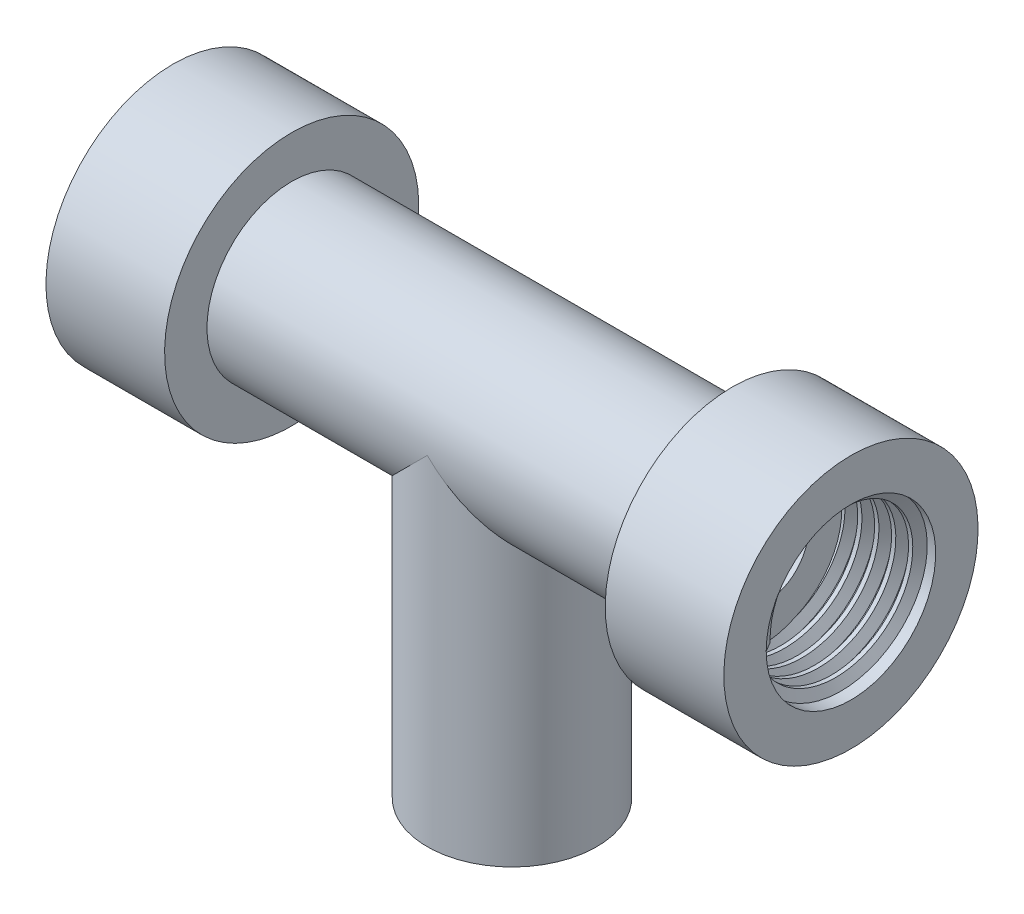
from build123d import *

# Parameters (mm, degrees)
SKETCH2_W          = 6.35
SKETCH2_H          = 25.4
SKETCH6_R          = 3.175
CUT_EXTRUDE1_DEPTH = 25.4
SKETCH7_R          = 3.175
CUT_EXTRUDE2_DEPTH = 44.704
THREAD1_PITCH      = 1.27
THREAD2_PITCH      = 1.27


with BuildPart() as part:
    # Sketch2 → Revolve1 (revolve)
    with BuildSketch(Plane.XY, mode=Mode.PRIVATE) as revolve1_sk:
        Rectangle(SKETCH2_W, SKETCH2_H)
    revolve(revolve1_sk.sketch.rotate(Axis((3.175, -12.7, 0), (0, 1, 0)), 270), axis=Axis((3.175, -12.7, 0), (0, 1, 0)))

    # Sketch4 → Revolve2 (revolve)
    with BuildSketch(Plane.XY, mode=Mode.PRIVATE) as revolve2_sk:
        Polygon((3.175, 12.7), (3.175, 6.35), (19.685, 6.35), (19.685, 3.175), (28.575, 3.175), (28.575, 6.35), (22.225, 6.35), (22.225, 12.7), align=None)
    revolve2 = revolve(revolve2_sk.sketch.rotate(Axis((22.225, 12.7, 0), (-1, 0, 0)), 180), axis=Axis((22.225, 12.7, 0), (-1, 0, 0)))

    # Mirror1: Revolve2 across plane
    add(revolve2.mirror(Plane(origin=(3.175, 12.7, 0), x_dir=(0, 0, 1), z_dir=(1, 0, 0))))

    # Sketch6 → Cut-Extrude1 (cut)
    with BuildSketch(Plane.XZ.offset(12.7)):
        with Locations(Location((3.175, 0, 0), (0, 0, 270))):
            Circle(SKETCH6_R)
    extrude(amount=-CUT_EXTRUDE1_DEPTH, mode=Mode.SUBTRACT)

    # Sketch7 → Cut-Extrude2 (cut)
    with BuildSketch(Plane(origin=(22.225, 0, 0), x_dir=(0, 0, -1), z_dir=(1, 0, 0))):
        with Locations(Location((0, 12.7, 0), (0, 0, 90))):
            Circle(SKETCH7_R)
    extrude(amount=-CUT_EXTRUDE2_DEPTH, mode=Mode.SUBTRACT)

    # Thread1: the profile of Thread Profile2 profile screwed along a right-hand helix of 5 turns, 8 arcs to a turn; built about Z, then put on its axis
    thread1_z = Axis((0, 0, 0), (0, 0, 1))
    thread1_corners = [(6.3503, 0, -0.000173205), (6.3503, 0, 1.111423202), (5.662592339, 0, 0.714374998), (5.662592339, 0, 0.396874998)]
    with BuildLine(mode=Mode.PRIVATE) as thread1_profile:
        Line(thread1_corners[0], thread1_corners[1])
        Line(thread1_corners[1], thread1_corners[2])
        Line(thread1_corners[2], thread1_corners[3])
        Line(thread1_corners[3], thread1_corners[0])
    thread1_cap = Face(thread1_profile.wire())
    thread1_turn_angles = [0, 22.5, 45, 67.5, 90, 112.5, 135, 157.5, 180, 202.5, 225, 247.5, 270, 292.5, 315, 337.5, 360]
    thread1_turn_weights = [1, 0.9238795325112867, 1, 0.9238795325112867, 1, 0.9238795325112867, 1, 0.9238795325112867, 1, 0.9238795325112867, 1, 0.9238795325112867, 1, 0.9238795325112867, 1, 0.9238795325112867, 1]
    thread1_turn_rails = [Edge.make_bspline([Vector(p[0], p[1], 0).rotate(thread1_z, thread1_turn_angles[k]) / thread1_turn_weights[k] + Vector(0, 0, p[2] + THREAD1_PITCH * thread1_turn_angles[k] / 360) for k in range(17)], [0, 0, 0, 1, 1, 2, 2, 3, 3, 4, 4, 5, 5, 6, 6, 7, 7, 8, 8, 8], 2, thread1_turn_weights) for p in thread1_corners]
    thread1_turn_sides = [Face.make_surface_from_curves(thread1_turn_rails[p[0]], thread1_turn_rails[p[1]]) for p in [(0, 1), (1, 2), (2, 3), (3, 0)]]
    thread1 = Plane(origin=(28.575, 12.7, 0), x_dir=(0, 0, 1), z_dir=(-1, 0, 0)) * Solid(Shell([*[p.moved(Location((0, 0, THREAD1_PITCH * i))) for i in range(5) for p in thread1_turn_sides], thread1_cap, thread1_cap.rotate(thread1_z, 1800).moved(Location((0, 0, THREAD1_PITCH * 1800 / 360)))]))
    add(thread1)

    # Thread2: the profile of Thread Profile3 profile screwed along a right-hand helix of 5 turns, 8 arcs to a turn; built about Z, then put on its axis
    thread2_z = Axis((0, 0, 0), (0, 0, 1))
    thread2_corners = [(6.3503, 0, -0.000173205), (6.3503, 0, 1.111423202), (5.662592339, 0, 0.714374998), (5.662592339, 0, 0.396874998)]
    with BuildLine(mode=Mode.PRIVATE) as thread2_profile:
        Line(thread2_corners[0], thread2_corners[1])
        Line(thread2_corners[1], thread2_corners[2])
        Line(thread2_corners[2], thread2_corners[3])
        Line(thread2_corners[3], thread2_corners[0])
    thread2_cap = Face(thread2_profile.wire())
    thread2_turn_angles = [0, 22.5, 45, 67.5, 90, 112.5, 135, 157.5, 180, 202.5, 225, 247.5, 270, 292.5, 315, 337.5, 360]
    thread2_turn_weights = [1, 0.9238795325112867, 1, 0.9238795325112867, 1, 0.9238795325112867, 1, 0.9238795325112867, 1, 0.9238795325112867, 1, 0.9238795325112867, 1, 0.9238795325112867, 1, 0.9238795325112867, 1]
    thread2_turn_rails = [Edge.make_bspline([Vector(p[0], p[1], 0).rotate(thread2_z, thread2_turn_angles[k]) / thread2_turn_weights[k] + Vector(0, 0, p[2] + THREAD2_PITCH * thread2_turn_angles[k] / 360) for k in range(17)], [0, 0, 0, 1, 1, 2, 2, 3, 3, 4, 4, 5, 5, 6, 6, 7, 7, 8, 8, 8], 2, thread2_turn_weights) for p in thread2_corners]
    thread2_turn_sides = [Face.make_surface_from_curves(thread2_turn_rails[p[0]], thread2_turn_rails[p[1]]) for p in [(0, 1), (1, 2), (2, 3), (3, 0)]]
    thread2 = Plane(origin=(-22.225, 12.7, 0), x_dir=(0, 0, -1), z_dir=(1, 0, 0)) * Solid(Shell([*[p.moved(Location((0, 0, THREAD2_PITCH * i))) for i in range(5) for p in thread2_turn_sides], thread2_cap, thread2_cap.rotate(thread2_z, 1800).moved(Location((0, 0, THREAD2_PITCH * 1800 / 360)))]))
    add(thread2)


solid = part.part
